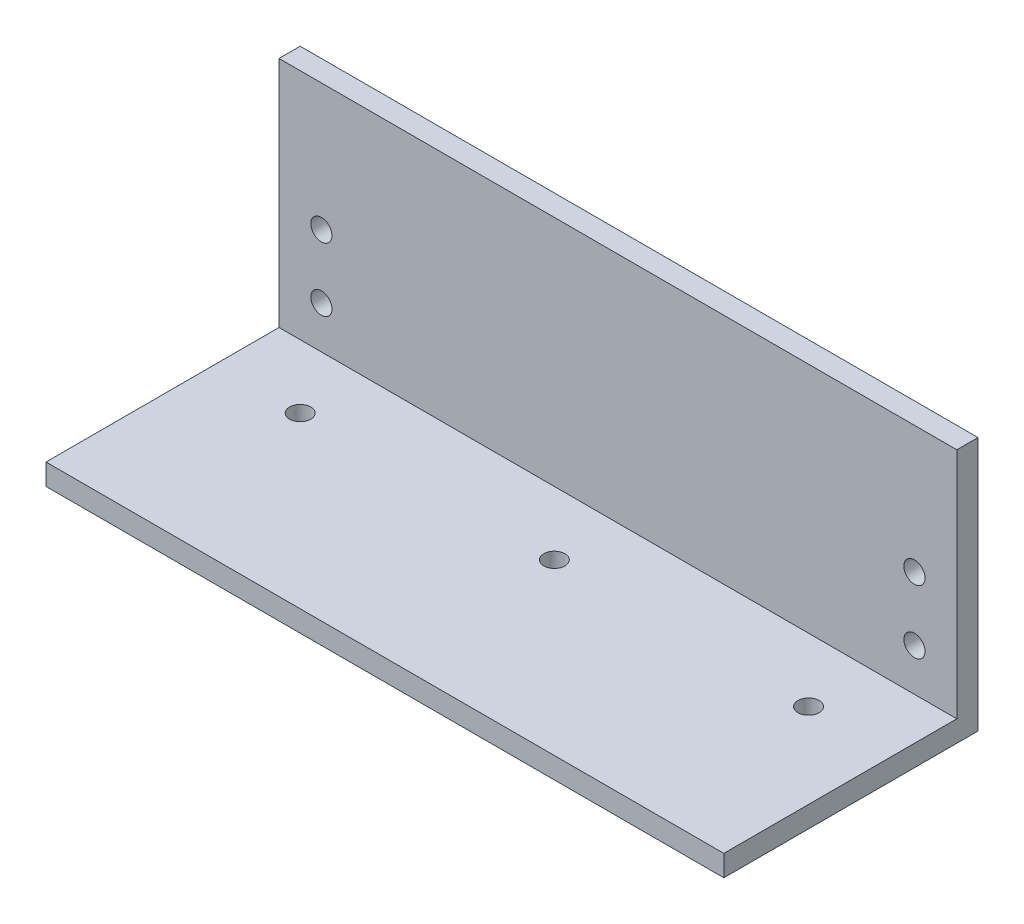
from build123d import *

# Parameters (mm, degrees)
BOSS_EXTRUDE2_DEPTH = 203.2
SKETCH4_R           = 3.175
CUT_EXTRUDE1_DEPTH  = 71.628
SKETCH5_R           = 3.175
CUT_EXTRUDE2_DEPTH  = 244.602


with BuildPart() as part:
    # Sketch2 → Boss-Extrude2 (new body)
    with BuildSketch(Plane(origin=(0, 0, 0), x_dir=(0, 0, -1), z_dir=(1, 0, 0))):
        Polygon((0, 6.35), (0, 0), (76.2, 0), (76.2, 76.2), (69.85, 76.2), (69.85, 6.35), align=None)
    extrude(amount=BOSS_EXTRUDE2_DEPTH)

    # Sketch4 → Cut-Extrude1 (cut)
    with BuildSketch(Plane(origin=(0, 0, -76.2), x_dir=(-1, 0, 0), z_dir=(0, 0, -1))):
        with Locations((-190.5, 19.05)):
            Circle(SKETCH4_R)
        with Locations((-190.5, 38.1)):
            Circle(SKETCH4_R)
        with Locations((-12.7, 19.05)):
            Circle(SKETCH4_R)
        with Locations((-12.7, 38.1)):
            Circle(SKETCH4_R)
    extrude(amount=-CUT_EXTRUDE1_DEPTH, mode=Mode.SUBTRACT)

    # Sketch5 → Cut-Extrude2 (cut)
    with BuildSketch(Plane(origin=(0, 6.35, 0), x_dir=(1, 0, 0), z_dir=(0, 1, 0))):
        with Locations((25.4, 50.8)):
            Circle(SKETCH5_R)
        with Locations((177.8, 50.8)):
            Circle(SKETCH5_R)
        with Locations((101.6, 50.8)):
            Circle(SKETCH5_R)
    extrude(amount=-CUT_EXTRUDE2_DEPTH, mode=Mode.SUBTRACT)


solid = part.part
